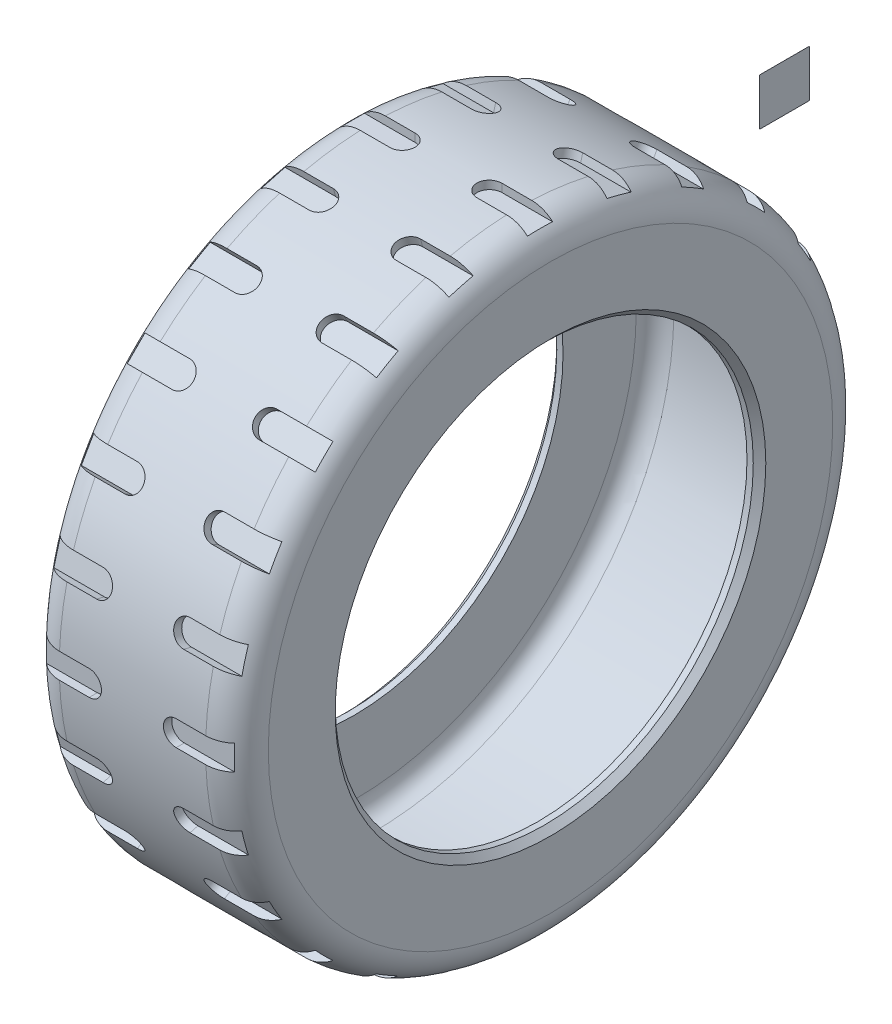
from build123d import *

# Parameters (mm, degrees)
CHAMFER1_SIZE        = 1.5
CUT_EXTRUDE4_DEPTH   = 2
CIRPATTERN1_START    = 73
CIRPATTERN1_DEPTH    = 3
CIRPATTERN1_START_2  = -76
CIRPATTERN1_2_DEPTH  = 3
CIRPATTERN1_3_DEPTH  = 3
CIRPATTERN1_4_DEPTH  = 3
CIRPATTERN1_5_DEPTH  = 3
CIRPATTERN1_6_DEPTH  = 3
CIRPATTERN1_7_DEPTH  = 3
CIRPATTERN1_8_DEPTH  = 3
CIRPATTERN1_9_DEPTH  = 3
CIRPATTERN1_10_DEPTH = 3
CIRPATTERN1_11_DEPTH = 3
CIRPATTERN1_12_DEPTH = 3
CIRPATTERN1_13_DEPTH = 3
CIRPATTERN1_14_DEPTH = 3
CIRPATTERN1_15_DEPTH = 3
CIRPATTERN1_16_DEPTH = 3
CIRPATTERN1_17_DEPTH = 3
CIRPATTERN1_18_DEPTH = 3
CIRPATTERN1_19_DEPTH = 3
CIRPATTERN1_20_DEPTH = 3
CIRPATTERN1_21_DEPTH = 3
CIRPATTERN1_22_DEPTH = 3
CIRPATTERN1_23_DEPTH = 3
SKETCH11_W           = 0.002
SKETCH11_H           = 11.269203881
BOSS_EXTRUDE4_DEPTH  = 12


with BuildPart() as part:
    # Sketch1 → Revolve1 (revolve)
    with BuildSketch(Plane.XY, mode=Mode.PRIVATE) as revolve1_sk:
        with BuildLine():
            Line((-187.142470276, 50), (-187.142470276, 67.5))
            ThreePointArc((-187.142470276, 67.5), (-184.945771135, 72.803300859), (-179.642470276, 75))
            Line((-179.642470276, 75), (-144.642470276, 75))
            ThreePointArc((-144.642470276, 75), (-139.339169418, 72.803300859), (-137.142470276, 67.5))
            Line((-137.142470276, 67.5), (-137.142470276, 50))
            Line((-137.142470276, 50), (-140.142470276, 50))
            Line((-140.142470276, 50), (-140.142470276, 67.5))
            ThreePointArc((-140.142470276, 67.5), (-141.460489761, 70.681980515), (-144.642470276, 72))
            Line((-144.642470276, 72), (-179.642470276, 72))
            ThreePointArc((-179.642470276, 72), (-182.824450792, 70.681980515), (-184.142470276, 67.5))
            Line((-184.142470276, 67.5), (-184.142470276, 50))
            Line((-184.142470276, 50), (-187.142470276, 50))
        make_face()
    revolve(revolve1_sk.sketch.rotate(Axis((850.772332558, 0, 0), (-1, 0, 0)), 90), axis=Axis((850.772332558, 0, 0), (-1, 0, 0)))

    # Chamfer1
    chamfer1_edges = [part.edges().sort_by_distance(p)[0] for p in [
        (-137.142470276, 0, 50),
        (-187.142470276, 0, 50),
    ]]
    chamfer(chamfer1_edges, length=CHAMFER1_SIZE)

    # Sketch3 → Cut-Extrude4 (cut)
    with BuildSketch(Plane(origin=(0, 0, -75), x_dir=(-1, 0, 0), z_dir=(0, 0, -1))):
        with BuildLine():
            Line((172.551830508, 3), (184.642470276, 3))
            Line((184.642470276, 3), (184.642470276, -3))
            Line((184.642470276, -3), (172.551830508, -3))
            ThreePointArc((172.551830508, -3), (169.551830508, 0), (172.551830508, 3))
        make_face()
    cut_extrude4 = extrude(amount=-CUT_EXTRUDE4_DEPTH, mode=Mode.SUBTRACT)

    # CirPattern1: read off the stored shape, not the designer's step
    # CirPattern1 outline → CirPattern1 (cut)
    with BuildSketch(Plane.XY.offset(CIRPATTERN1_START)):
        with BuildLine():
            Line((-184.642470276, -3), (-172.551830508, -3))
            ThreePointArc((-172.551830508, -3), (-169.551830508, 0), (-172.551830508, 3))
            Line((-172.551830508, 3), (-184.642470276, 3))
            Line((-184.642470276, 3), (-184.642470276, -3))
        make_face()
    cirpattern1 = extrude(amount=CIRPATTERN1_DEPTH, mode=Mode.SUBTRACT)

    # CirPattern1 2 outline → CirPattern1 2 (cut)
    with BuildSketch(Plane(origin=(0, 0, 0), x_dir=(1, 0, 0), z_dir=(0, 0.2588190451025211, -0.9659258262890682)).offset(CIRPATTERN1_START_2)):
        with BuildLine():
            Line((-172.551830508, 3), (-184.642470276, 3))
            Line((-184.642470276, 3), (-184.642470276, -3))
            Line((-184.642470276, -3), (-172.551830508, -3))
            ThreePointArc((-172.551830508, -3), (-169.551830508, 0), (-172.551830508, 3))
        make_face()
    cirpattern1_2 = extrude(amount=CIRPATTERN1_2_DEPTH, mode=Mode.SUBTRACT)

    # CirPattern1 3 outline → CirPattern1 3 (cut)
    with BuildSketch(Plane(origin=(0, 0, 0), x_dir=(1, 0, 0), z_dir=(0, 0.2588190451025211, -0.9659258262890682)).offset(CIRPATTERN1_START)):
        with BuildLine():
            Line((-172.551830508, 3), (-184.642470276, 3))
            Line((-184.642470276, 3), (-184.642470276, -3))
            Line((-184.642470276, -3), (-172.551830508, -3))
            ThreePointArc((-172.551830508, -3), (-169.551830508, 0), (-172.551830508, 3))
        make_face()
    cirpattern1_3 = extrude(amount=CIRPATTERN1_3_DEPTH, mode=Mode.SUBTRACT)

    # CirPattern1 4 outline → CirPattern1 4 (cut)
    with BuildSketch(Plane(origin=(0, 0, 0), x_dir=(1, 0, 0), z_dir=(0, 0.965925826289071, -0.258819045102511)).offset(CIRPATTERN1_START_2)):
        with BuildLine():
            Line((-172.551830508, 3), (-184.642470276, 3))
            Line((-184.642470276, 3), (-184.642470276, -3))
            Line((-184.642470276, -3), (-172.551830508, -3))
            ThreePointArc((-172.551830508, -3), (-169.551830508, 0), (-172.551830508, 3))
        make_face()
    cirpattern1_4 = extrude(amount=CIRPATTERN1_4_DEPTH, mode=Mode.SUBTRACT)

    # CirPattern1 5 outline → CirPattern1 5 (cut)
    with BuildSketch(Plane(origin=(0, 0, 0), x_dir=(1, 0, 0), z_dir=(0, 0.965925826289071, -0.258819045102511)).offset(CIRPATTERN1_START)):
        with BuildLine():
            Line((-172.551830508, 3), (-184.642470276, 3))
            Line((-184.642470276, 3), (-184.642470276, -3))
            Line((-184.642470276, -3), (-172.551830508, -3))
            ThreePointArc((-172.551830508, -3), (-169.551830508, 0), (-172.551830508, 3))
        make_face()
    cirpattern1_5 = extrude(amount=CIRPATTERN1_5_DEPTH, mode=Mode.SUBTRACT)

    # CirPattern1 6 outline → CirPattern1 6 (cut)
    with BuildSketch(Plane(origin=(0, 0, 0), x_dir=(1, 0, 0), z_dir=(0, 0.8660254037844433, -0.4999999999999921)).offset(CIRPATTERN1_START_2)):
        with BuildLine():
            Line((-172.551830508, 3), (-184.642470276, 3))
            Line((-184.642470276, 3), (-184.642470276, -3))
            Line((-184.642470276, -3), (-172.551830508, -3))
            ThreePointArc((-172.551830508, -3), (-169.551830508, 0), (-172.551830508, 3))
        make_face()
    cirpattern1_6 = extrude(amount=CIRPATTERN1_6_DEPTH, mode=Mode.SUBTRACT)

    # CirPattern1 7 outline → CirPattern1 7 (cut)
    with BuildSketch(Plane(origin=(0, 0, 0), x_dir=(1, 0, 0), z_dir=(0, 0.8660254037844433, -0.4999999999999921)).offset(CIRPATTERN1_START)):
        with BuildLine():
            Line((-172.551830508, 3), (-184.642470276, 3))
            Line((-184.642470276, 3), (-184.642470276, -3))
            Line((-184.642470276, -3), (-172.551830508, -3))
            ThreePointArc((-172.551830508, -3), (-169.551830508, 0), (-172.551830508, 3))
        make_face()
    cirpattern1_7 = extrude(amount=CIRPATTERN1_7_DEPTH, mode=Mode.SUBTRACT)

    # CirPattern1 8 outline → CirPattern1 8 (cut)
    with BuildSketch(Plane(origin=(0, 0, 0), x_dir=(1, 0, 0), z_dir=(0, 0.707106781186554, -0.707106781186541)).offset(CIRPATTERN1_START_2)):
        with BuildLine():
            Line((-172.551830508, 3), (-184.642470276, 3))
            Line((-184.642470276, 3), (-184.642470276, -3))
            Line((-184.642470276, -3), (-172.551830508, -3))
            ThreePointArc((-172.551830508, -3), (-169.551830508, 0), (-172.551830508, 3))
        make_face()
    cirpattern1_8 = extrude(amount=CIRPATTERN1_8_DEPTH, mode=Mode.SUBTRACT)

    # CirPattern1 9 outline → CirPattern1 9 (cut)
    with BuildSketch(Plane(origin=(0, 0, 0), x_dir=(1, 0, 0), z_dir=(0, 0.707106781186554, -0.707106781186541)).offset(CIRPATTERN1_START)):
        with BuildLine():
            Line((-172.551830508, 3), (-184.642470276, 3))
            Line((-184.642470276, 3), (-184.642470276, -3))
            Line((-184.642470276, -3), (-172.551830508, -3))
            ThreePointArc((-172.551830508, -3), (-169.551830508, 0), (-172.551830508, 3))
        make_face()
    cirpattern1_9 = extrude(amount=CIRPATTERN1_9_DEPTH, mode=Mode.SUBTRACT)

    # CirPattern1 10 outline → CirPattern1 10 (cut)
    with BuildSketch(Plane(origin=(0, 0, 0), x_dir=(1, 0, 0), z_dir=(0, 0.5000000000000068, -0.8660254037844347)).offset(CIRPATTERN1_START_2)):
        with BuildLine():
            Line((-172.551830508, 3), (-184.642470276, 3))
            Line((-184.642470276, 3), (-184.642470276, -3))
            Line((-184.642470276, -3), (-172.551830508, -3))
            ThreePointArc((-172.551830508, -3), (-169.551830508, 0), (-172.551830508, 3))
        make_face()
    cirpattern1_10 = extrude(amount=CIRPATTERN1_10_DEPTH, mode=Mode.SUBTRACT)

    # CirPattern1 11 outline → CirPattern1 11 (cut)
    with BuildSketch(Plane(origin=(0, 0, 0), x_dir=(1, 0, 0), z_dir=(0, 0.5000000000000068, -0.8660254037844347)).offset(CIRPATTERN1_START)):
        with BuildLine():
            Line((-172.551830508, 3), (-184.642470276, 3))
            Line((-184.642470276, 3), (-184.642470276, -3))
            Line((-184.642470276, -3), (-172.551830508, -3))
            ThreePointArc((-172.551830508, -3), (-169.551830508, 0), (-172.551830508, 3))
        make_face()
    cirpattern1_11 = extrude(amount=CIRPATTERN1_11_DEPTH, mode=Mode.SUBTRACT)

    # CirPattern1 12 outline → CirPattern1 12 (cut)
    with BuildSketch(Plane(origin=(0, 0, 0), x_dir=(1, 0, 0), z_dir=(0, 0.258819045102515, 0.9659258262890699)).offset(CIRPATTERN1_START_2)):
        with BuildLine():
            Line((-172.551830508, 3), (-184.642470276, 3))
            Line((-184.642470276, 3), (-184.642470276, -3))
            Line((-184.642470276, -3), (-172.551830508, -3))
            ThreePointArc((-172.551830508, -3), (-169.551830508, 0), (-172.551830508, 3))
        make_face()
    cirpattern1_12 = extrude(amount=CIRPATTERN1_12_DEPTH, mode=Mode.SUBTRACT)

    # CirPattern1 13 outline → CirPattern1 13 (cut)
    with BuildSketch(Plane(origin=(0, 0, 0), x_dir=(1, 0, 0), z_dir=(0, 0.258819045102515, 0.9659258262890699)).offset(CIRPATTERN1_START)):
        with BuildLine():
            Line((-172.551830508, 3), (-184.642470276, 3))
            Line((-184.642470276, 3), (-184.642470276, -3))
            Line((-184.642470276, -3), (-172.551830508, -3))
            ThreePointArc((-172.551830508, -3), (-169.551830508, 0), (-172.551830508, 3))
        make_face()
    cirpattern1_13 = extrude(amount=CIRPATTERN1_13_DEPTH, mode=Mode.SUBTRACT)

    # CirPattern1 14 outline → CirPattern1 14 (cut)
    with BuildSketch(Plane(origin=(0, 0, 0), x_dir=(1, 0, 0), z_dir=(0, 0.4999999999999948, 0.8660254037844417)).offset(CIRPATTERN1_START_2)):
        with BuildLine():
            Line((-172.551830508, 3), (-184.642470276, 3))
            Line((-184.642470276, 3), (-184.642470276, -3))
            Line((-184.642470276, -3), (-172.551830508, -3))
            ThreePointArc((-172.551830508, -3), (-169.551830508, 0), (-172.551830508, 3))
        make_face()
    cirpattern1_14 = extrude(amount=CIRPATTERN1_14_DEPTH, mode=Mode.SUBTRACT)

    # CirPattern1 15 outline → CirPattern1 15 (cut)
    with BuildSketch(Plane(origin=(0, 0, 0), x_dir=(1, 0, 0), z_dir=(0, 0.4999999999999948, 0.8660254037844417)).offset(CIRPATTERN1_START)):
        with BuildLine():
            Line((-172.551830508, 3), (-184.642470276, 3))
            Line((-184.642470276, 3), (-184.642470276, -3))
            Line((-184.642470276, -3), (-172.551830508, -3))
            ThreePointArc((-172.551830508, -3), (-169.551830508, 0), (-172.551830508, 3))
        make_face()
    cirpattern1_15 = extrude(amount=CIRPATTERN1_15_DEPTH, mode=Mode.SUBTRACT)

    # CirPattern1 16 outline → CirPattern1 16 (cut)
    with BuildSketch(Plane(origin=(0, 0, 0), x_dir=(1, 0, 0), z_dir=(0, 0.707106781186544, 0.707106781186551)).offset(CIRPATTERN1_START_2)):
        with BuildLine():
            Line((-172.551830508, 3), (-184.642470276, 3))
            Line((-184.642470276, 3), (-184.642470276, -3))
            Line((-184.642470276, -3), (-172.551830508, -3))
            ThreePointArc((-172.551830508, -3), (-169.551830508, 0), (-172.551830508, 3))
        make_face()
    cirpattern1_16 = extrude(amount=CIRPATTERN1_16_DEPTH, mode=Mode.SUBTRACT)

    # CirPattern1 17 outline → CirPattern1 17 (cut)
    with BuildSketch(Plane(origin=(0, 0, 0), x_dir=(1, 0, 0), z_dir=(0, 0.707106781186544, 0.707106781186551)).offset(CIRPATTERN1_START)):
        with BuildLine():
            Line((-172.551830508, 3), (-184.642470276, 3))
            Line((-184.642470276, 3), (-184.642470276, -3))
            Line((-184.642470276, -3), (-172.551830508, -3))
            ThreePointArc((-172.551830508, -3), (-169.551830508, 0), (-172.551830508, 3))
        make_face()
    cirpattern1_17 = extrude(amount=CIRPATTERN1_17_DEPTH, mode=Mode.SUBTRACT)

    # CirPattern1 18 outline → CirPattern1 18 (cut)
    with BuildSketch(Plane(origin=(0, 0, 0), x_dir=(1, 0, 0), z_dir=(0, 0.8660254037844363, 0.5000000000000042)).offset(CIRPATTERN1_START_2)):
        with BuildLine():
            Line((-172.551830508, 3), (-184.642470276, 3))
            Line((-184.642470276, 3), (-184.642470276, -3))
            Line((-184.642470276, -3), (-172.551830508, -3))
            ThreePointArc((-172.551830508, -3), (-169.551830508, 0), (-172.551830508, 3))
        make_face()
    cirpattern1_18 = extrude(amount=CIRPATTERN1_18_DEPTH, mode=Mode.SUBTRACT)

    # CirPattern1 19 outline → CirPattern1 19 (cut)
    with BuildSketch(Plane(origin=(0, 0, 0), x_dir=(1, 0, 0), z_dir=(0, 0.8660254037844363, 0.5000000000000042)).offset(CIRPATTERN1_START)):
        with BuildLine():
            Line((-172.551830508, 3), (-184.642470276, 3))
            Line((-184.642470276, 3), (-184.642470276, -3))
            Line((-184.642470276, -3), (-172.551830508, -3))
            ThreePointArc((-172.551830508, -3), (-169.551830508, 0), (-172.551830508, 3))
        make_face()
    cirpattern1_19 = extrude(amount=CIRPATTERN1_19_DEPTH, mode=Mode.SUBTRACT)

    # CirPattern1 20 outline → CirPattern1 20 (cut)
    with BuildSketch(Plane(origin=(0, 0, 0), x_dir=(1, 0, 0), z_dir=(0, 0.9659258262890672, 0.25881904510252507)).offset(CIRPATTERN1_START_2)):
        with BuildLine():
            Line((-172.551830508, 3), (-184.642470276, 3))
            Line((-184.642470276, 3), (-184.642470276, -3))
            Line((-184.642470276, -3), (-172.551830508, -3))
            ThreePointArc((-172.551830508, -3), (-169.551830508, 0), (-172.551830508, 3))
        make_face()
    cirpattern1_20 = extrude(amount=CIRPATTERN1_20_DEPTH, mode=Mode.SUBTRACT)

    # CirPattern1 21 outline → CirPattern1 21 (cut)
    with BuildSketch(Plane(origin=(0, 0, 0), x_dir=(1, 0, 0), z_dir=(0, 0.9659258262890672, 0.25881904510252507)).offset(CIRPATTERN1_START)):
        with BuildLine():
            Line((-172.551830508, 3), (-184.642470276, 3))
            Line((-184.642470276, 3), (-184.642470276, -3))
            Line((-184.642470276, -3), (-172.551830508, -3))
            ThreePointArc((-172.551830508, -3), (-169.551830508, 0), (-172.551830508, 3))
        make_face()
    cirpattern1_21 = extrude(amount=CIRPATTERN1_21_DEPTH, mode=Mode.SUBTRACT)

    # CirPattern1 22 outline → CirPattern1 22 (cut)
    with BuildSketch(Plane(origin=(0, 0, 0), x_dir=(1, 0, 0), z_dir=(0, 1, 0)).offset(CIRPATTERN1_START_2)):
        with BuildLine():
            Line((-172.551830508, 3), (-184.642470276, 3))
            Line((-184.642470276, 3), (-184.642470276, -3))
            Line((-184.642470276, -3), (-172.551830508, -3))
            ThreePointArc((-172.551830508, -3), (-169.551830508, 0), (-172.551830508, 3))
        make_face()
    cirpattern1_22 = extrude(amount=CIRPATTERN1_22_DEPTH, mode=Mode.SUBTRACT)

    # CirPattern1 23 outline → CirPattern1 23 (cut)
    with BuildSketch(Plane(origin=(0, 0, 0), x_dir=(1, 0, 0), z_dir=(0, 1, 0)).offset(CIRPATTERN1_START)):
        with BuildLine():
            Line((-172.551830508, 3), (-184.642470276, 3))
            Line((-184.642470276, 3), (-184.642470276, -3))
            Line((-184.642470276, -3), (-172.551830508, -3))
            ThreePointArc((-172.551830508, -3), (-169.551830508, 0), (-172.551830508, 3))
        make_face()
    cirpattern1_23 = extrude(amount=CIRPATTERN1_23_DEPTH, mode=Mode.SUBTRACT)

    # Mirror1: Cut-Extrude4, CirPattern1, CirPattern1 2, CirPattern1 3, CirPattern1 4, CirPattern1 5, CirPattern1 6, CirPattern1 7, CirPattern1 8, CirPattern1 9, CirPattern1 10, CirPattern1 11, CirPattern1 12, CirPattern1 13, CirPattern1 14, CirPattern1 15, CirPattern1 16, CirPattern1 17, CirPattern1 18, CirPattern1 19, CirPattern1 20, CirPattern1 21, CirPattern1 22, CirPattern1 23 across plane
    add(cut_extrude4.mirror(Plane(origin=(-162.144470276, 0, 0), x_dir=(0, 0, 1), z_dir=(1, 0, 0))), mode=Mode.SUBTRACT)
    add(cirpattern1.mirror(Plane(origin=(-162.144470276, 0, 0), x_dir=(0, 0, 1), z_dir=(1, 0, 0))), mode=Mode.SUBTRACT)
    add(cirpattern1_2.mirror(Plane(origin=(-162.144470276, 0, 0), x_dir=(0, 0, 1), z_dir=(1, 0, 0))), mode=Mode.SUBTRACT)
    add(cirpattern1_3.mirror(Plane(origin=(-162.144470276, 0, 0), x_dir=(0, 0, 1), z_dir=(1, 0, 0))), mode=Mode.SUBTRACT)
    add(cirpattern1_4.mirror(Plane(origin=(-162.144470276, 0, 0), x_dir=(0, 0, 1), z_dir=(1, 0, 0))), mode=Mode.SUBTRACT)
    add(cirpattern1_5.mirror(Plane(origin=(-162.144470276, 0, 0), x_dir=(0, 0, 1), z_dir=(1, 0, 0))), mode=Mode.SUBTRACT)
    add(cirpattern1_6.mirror(Plane(origin=(-162.144470276, 0, 0), x_dir=(0, 0, 1), z_dir=(1, 0, 0))), mode=Mode.SUBTRACT)
    add(cirpattern1_7.mirror(Plane(origin=(-162.144470276, 0, 0), x_dir=(0, 0, 1), z_dir=(1, 0, 0))), mode=Mode.SUBTRACT)
    add(cirpattern1_8.mirror(Plane(origin=(-162.144470276, 0, 0), x_dir=(0, 0, 1), z_dir=(1, 0, 0))), mode=Mode.SUBTRACT)
    add(cirpattern1_9.mirror(Plane(origin=(-162.144470276, 0, 0), x_dir=(0, 0, 1), z_dir=(1, 0, 0))), mode=Mode.SUBTRACT)
    add(cirpattern1_10.mirror(Plane(origin=(-162.144470276, 0, 0), x_dir=(0, 0, 1), z_dir=(1, 0, 0))), mode=Mode.SUBTRACT)
    add(cirpattern1_11.mirror(Plane(origin=(-162.144470276, 0, 0), x_dir=(0, 0, 1), z_dir=(1, 0, 0))), mode=Mode.SUBTRACT)
    add(cirpattern1_12.mirror(Plane(origin=(-162.144470276, 0, 0), x_dir=(0, 0, 1), z_dir=(1, 0, 0))), mode=Mode.SUBTRACT)
    add(cirpattern1_13.mirror(Plane(origin=(-162.144470276, 0, 0), x_dir=(0, 0, 1), z_dir=(1, 0, 0))), mode=Mode.SUBTRACT)
    add(cirpattern1_14.mirror(Plane(origin=(-162.144470276, 0, 0), x_dir=(0, 0, 1), z_dir=(1, 0, 0))), mode=Mode.SUBTRACT)
    add(cirpattern1_15.mirror(Plane(origin=(-162.144470276, 0, 0), x_dir=(0, 0, 1), z_dir=(1, 0, 0))), mode=Mode.SUBTRACT)
    add(cirpattern1_16.mirror(Plane(origin=(-162.144470276, 0, 0), x_dir=(0, 0, 1), z_dir=(1, 0, 0))), mode=Mode.SUBTRACT)
    add(cirpattern1_17.mirror(Plane(origin=(-162.144470276, 0, 0), x_dir=(0, 0, 1), z_dir=(1, 0, 0))), mode=Mode.SUBTRACT)
    add(cirpattern1_18.mirror(Plane(origin=(-162.144470276, 0, 0), x_dir=(0, 0, 1), z_dir=(1, 0, 0))), mode=Mode.SUBTRACT)
    add(cirpattern1_19.mirror(Plane(origin=(-162.144470276, 0, 0), x_dir=(0, 0, 1), z_dir=(1, 0, 0))), mode=Mode.SUBTRACT)
    add(cirpattern1_20.mirror(Plane(origin=(-162.144470276, 0, 0), x_dir=(0, 0, 1), z_dir=(1, 0, 0))), mode=Mode.SUBTRACT)
    add(cirpattern1_21.mirror(Plane(origin=(-162.144470276, 0, 0), x_dir=(0, 0, 1), z_dir=(1, 0, 0))), mode=Mode.SUBTRACT)
    add(cirpattern1_22.mirror(Plane(origin=(-162.144470276, 0, 0), x_dir=(0, 0, 1), z_dir=(1, 0, 0))), mode=Mode.SUBTRACT)
    add(cirpattern1_23.mirror(Plane(origin=(-162.144470276, 0, 0), x_dir=(0, 0, 1), z_dir=(1, 0, 0))), mode=Mode.SUBTRACT)


with BuildPart() as body_2:
    # Sketch11 → Boss-Extrude4 (new body)
    with BuildSketch(Plane(origin=(0, 0, -75), x_dir=(-1, 0, 0), z_dir=(0, 0, -1))):
        with Locations((162.145470276, 50.532747509)):
            Rectangle(SKETCH11_W, SKETCH11_H)
    extrude(amount=BOSS_EXTRUDE4_DEPTH)


solid = Compound([part.part, body_2.part])
